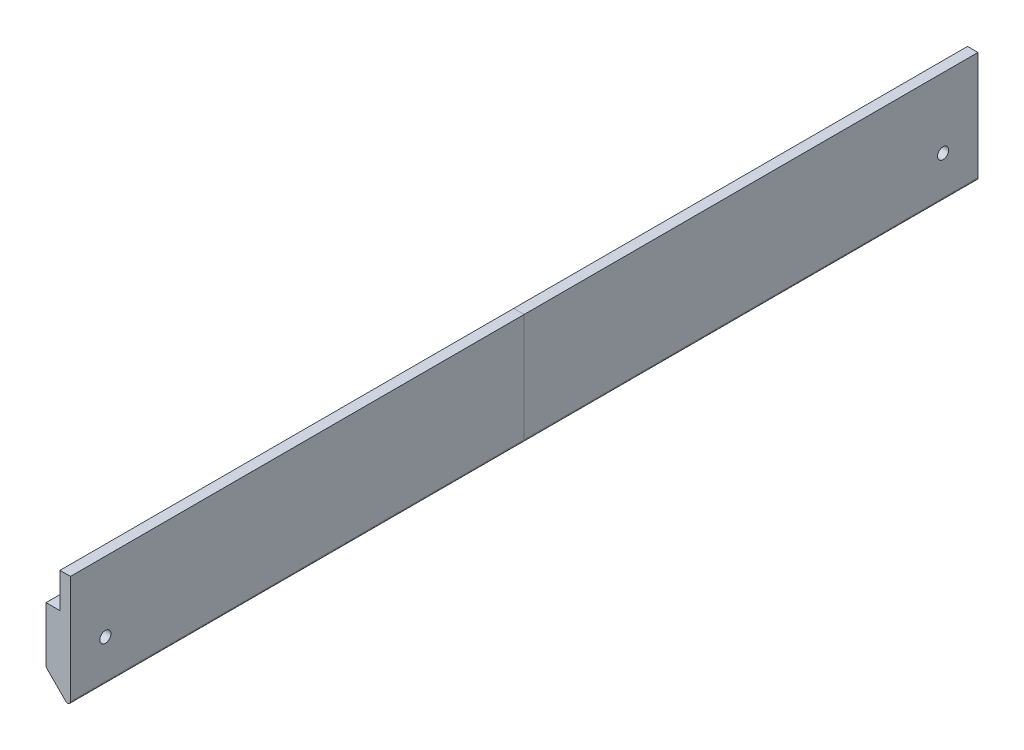
from build123d import *

# Parameters (mm, degrees)
BOSS_EXTRUDE1_DEPTH           = 260
FILLET1_R                     = 1.5
SKETCH2_W                     = 20
SKETCH2_H                     = 260
CUT_EXTRUDE1_DEPTH            = 10
FILLET2_R                     = 0.8
SKETCH4_W                     = 3
SKETCH4_H                     = 260
BOSS_EXTRUDE2_DEPTH           = 10
SKETCH3_W                     = 260
SKETCH3_H                     = 13
BOSS_EXTRUDE3_DEPTH           = 4
CSK_FOR_M3_SFHCS1_D           = 3.2
CSK_FOR_M3_SFHCS1_CSINK_D     = 6.72
CSK_FOR_M3_SFHCS1_CSINK_ANGLE = 90
SPLIT1_SURFACE_1_BACK         = 263.039
SPLIT1_SURFACE_1_DEPTH        = 526.078
SPLIT1_SURFACE_2_BACK         = 263.039
SPLIT1_SURFACE_2_DEPTH        = 526.078


with BuildPart() as part:
    # Sketch1 → Boss-Extrude1 (new body)
    with BuildSketch(Plane.XY.offset(280)):
        Polygon((-7, 4), (4, -7), (7, -7), (7, -3), (20, -3), (20, 0), (0, 0), (0, 20), (-3, 20), (-3, 7), (-7, 7), align=None)
    extrude(amount=-BOSS_EXTRUDE1_DEPTH)

    # Fillet1
    fillet1_edges = [part.edges().sort_by_distance(p)[0] for p in [
        (-7, 4, 150),
        (4, -7, 150),
    ]]
    fillet(fillet1_edges, radius=FILLET1_R)

    # Sketch2 → Cut-Extrude1 (cut)
    with BuildSketch(Plane(origin=(0, 0, 0), x_dir=(1, 0, 0), z_dir=(0, 1, 0))):
        with Locations((10, -150)):
            Rectangle(SKETCH2_W, SKETCH2_H)
    extrude(amount=-CUT_EXTRUDE1_DEPTH, mode=Mode.SUBTRACT)

    # Fillet2
    fillet2_edges = [part.edges().sort_by_distance(p)[0] for p in [
        (0, -3, 150),
    ]]
    fillet(fillet2_edges, radius=FILLET2_R)

    # Sketch4 → Boss-Extrude2 (add)
    with BuildSketch(Plane(origin=(0, 20, 0), x_dir=(1, 0, 0), z_dir=(0, 1, 0))):
        with Locations((-1.5, -150)):
            Rectangle(SKETCH4_W, SKETCH4_H)
    extrude(amount=BOSS_EXTRUDE2_DEPTH)

    # Sketch3 → Boss-Extrude3 (add)
    with BuildSketch(Plane.ZY.offset(3)):
        with Locations((150, 13.5)):
            Rectangle(SKETCH3_W, SKETCH3_H)
    extrude(amount=BOSS_EXTRUDE3_DEPTH)

    # CSK for M3 SFHCS1 (through all)
    with Locations(Plane.ZY.offset(7)):
        with Locations((30, 10), (270, 10)):
            CounterSinkHole(CSK_FOR_M3_SFHCS1_D / 2, CSK_FOR_M3_SFHCS1_CSINK_D / 2, counter_sink_angle=CSK_FOR_M3_SFHCS1_CSINK_ANGLE)


with BuildPart() as body_2:
    # Split1: the piece behind the surface
    add(part.part)
    # Split1 surface: a surface, the sketch's curves swept straight by 526.078 mm
    with BuildLine(Plane(origin=(0, 0, 0), x_dir=(0, 0, -1), z_dir=(1, 0, 0)).offset(-SPLIT1_SURFACE_1_BACK), mode=Mode.PRIVATE) as split1_surface_1_path:
        Line((-150, 30), (-150, -1.86862915))
    split1_surface_1 = Shell.extrude(split1_surface_1_path.wire(), (1 * SPLIT1_SURFACE_1_DEPTH, 0 * SPLIT1_SURFACE_1_DEPTH, 0 * SPLIT1_SURFACE_1_DEPTH))
    split(bisect_by=split1_surface_1, keep=Keep.BOTTOM)


with BuildPart() as part_1:
    add(part.part)

    # Split1: split by a surface, the side it looks to stays
    # Split1 surface: a surface, the sketch's curves swept straight by 526.078 mm
    with BuildLine(Plane(origin=(0, 0, 0), x_dir=(0, 0, -1), z_dir=(1, 0, 0)).offset(-SPLIT1_SURFACE_2_BACK), mode=Mode.PRIVATE) as split1_surface_2_path:
        Line((-150, 30), (-150, -1.86862915))
    split1_surface_2 = Shell.extrude(split1_surface_2_path.wire(), (1 * SPLIT1_SURFACE_2_DEPTH, 0 * SPLIT1_SURFACE_2_DEPTH, 0 * SPLIT1_SURFACE_2_DEPTH))
    split(bisect_by=split1_surface_2, keep=Keep.TOP)


solid = Compound([body_2.part, part_1.part])
